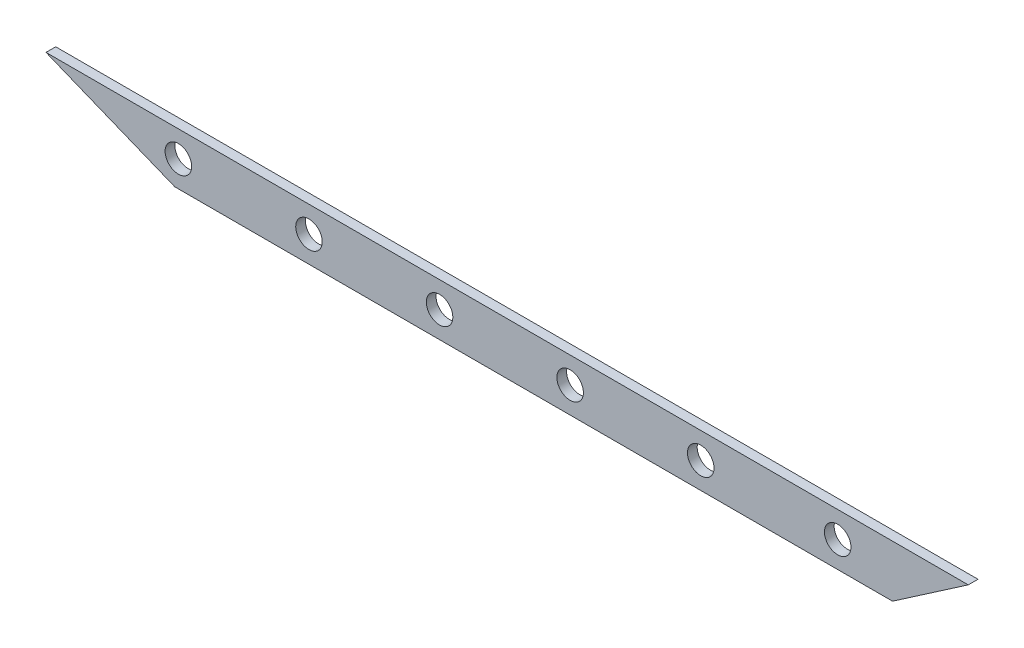
from build123d import *

# Parameters (mm, degrees)
BOSS_EXTRUDE1_DEPTH = 4.7625
SKETCH1_4_R         = 6.5
CUT_EXTRUDE1_DEPTH  = 439.920211962
CUT_EXTRUDE3_DEPTH  = 10
CUT_EXTRUDE4_REACH  = 440.92


with BuildPart() as part:
    # Sketch1 → Boss-Extrude1 (new body)
    with BuildSketch(Plane.XY):
        Polygon((428.120588235, 28.570833333), (0, 28.570833333), (-98.879411765, 3.850980392), (-31.879411765, -96.649019608), (366, -96.649019608), (403.120588235, -71.149019608), align=None)
    extrude(amount=BOSS_EXTRUDE1_DEPTH)

    # Sketch1<4> → Cut-Extrude1 (cut, through all)
    with BuildSketch(Plane.XY):
        with Locations((16, -83.899019608)):
            Circle(SKETCH1_4_R)
        with Locations((80, -83.899019608)):
            Circle(SKETCH1_4_R)
        with Locations((144, -83.899019608)):
            Circle(SKETCH1_4_R)
        with Locations((208, -83.899019608)):
            Circle(SKETCH1_4_R)
        with Locations((272, -83.899019608)):
            Circle(SKETCH1_4_R)
        with Locations((339.120588235, -83.899019608)):
            Circle(SKETCH1_4_R)
    extrude(amount=CUT_EXTRUDE1_DEPTH, mode=Mode.SUBTRACT)

    # Sketch6 → Cut-Extrude3 (cut)
    with BuildSketch(Plane.XY.offset(4.7625)):
        Polygon((-48.879411765, -71.149019608), (14.235302997, -96.649019608), (-31.879411765, -96.649019608), align=None)
    extrude(amount=-CUT_EXTRUDE3_DEPTH, mode=Mode.SUBTRACT)

    # Sketch7 → Cut-Extrude4 (cut, up to next)
    with BuildSketch(Plane.XY.offset(4.7625), mode=Mode.PRIVATE) as cut_extrude4_sk1:
        Polygon((-48.879411765, -71.149019608), (403.120588235, -71.149019608), (428.120588235, 28.570833333), (0, 28.570833333), (-98.879411765, 3.850980392), align=None)
    cut_extrude4_tool1 = extrude(cut_extrude4_sk1.sketch, amount=-CUT_EXTRUDE4_REACH, mode=Mode.PRIVATE) & part.part
    add(cut_extrude4_tool1.solids().sort_by_distance((173.467548, -20.947586, 4.7625))[0], mode=Mode.SUBTRACT)


solid = part.part
